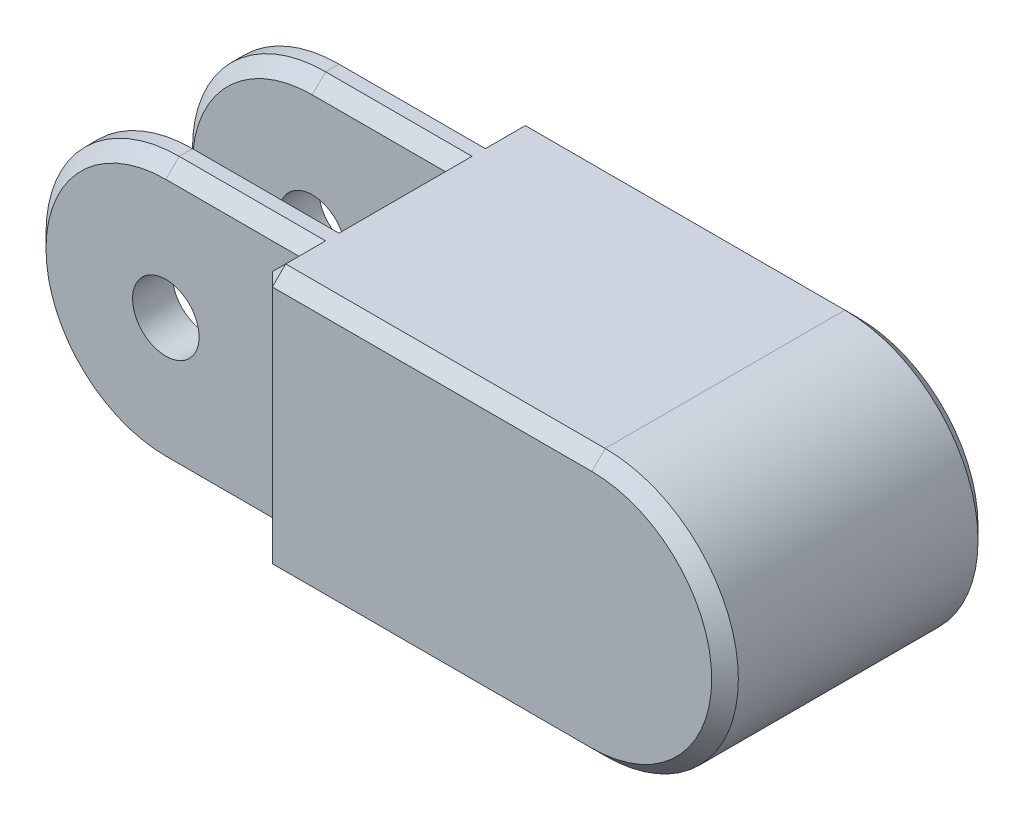
from build123d import *

# Parameters (mm, degrees)
BOSS_EXTRUDE1_DEPTH = 10
CUT_EXTRUDE1_DEPTH  = 4
CUT_EXTRUDE2_START  = -7
CUT_EXTRUDE2_DEPTH  = 7
CUT_EXTRUDE3_START  = 14
CUT_EXTRUDE3_DEPTH  = 7
SKETCH3_R           = 2.5
CUT_EXTRUDE4_DEPTH  = 10
SHELL1_START        = -7
SHELL1_DEPTH        = 14
SHELL1_START_2      = -4
SHELL1_2_OUTLINE_W  = 3
SHELL1_2_OUTLINE_H  = 14
SHELL1_2_DEPTH      = 8
CHAMFER1_SIZE       = 1


# Read off the part's stored shape, not the designer's step: Shell1
with BuildPart() as part:
    # Sketch1 → Boss-Extrude1 (new, symmetric)
    with BuildSketch(Plane.XY):
        with BuildLine():
            Line((-17.5, 10), (17.5, 10))
            ThreePointArc((17.5, 10), (27.5, 0), (17.5, -10))
            Line((17.5, -10), (-17.5, -10))
            ThreePointArc((-17.5, -10), (-27.5, 0), (-17.5, 10))
        make_face()
    extrude(amount=BOSS_EXTRUDE1_DEPTH, both=True)

    # Sketch2 → Cut-Extrude1 (cut, symmetric)
    with BuildSketch(Plane.XY):
        with BuildLine():
            Line((-17.5, 10), (-7.5, 10))
            Line((-7.5, 10), (-7.5, -10))
            Line((-7.5, -10), (-17.5, -10))
            ThreePointArc((-17.5, -10), (-27.5, 0), (-17.5, 10))
        make_face()
    extrude(amount=CUT_EXTRUDE1_DEPTH, both=True, mode=Mode.SUBTRACT)

    # Sketch2<2> → Cut-Extrude2 (cut)
    with BuildSketch(Plane.XY.offset(CUT_EXTRUDE2_START)):
        with BuildLine():
            Line((-17.5, 10), (-7.5, 10))
            Line((-7.5, 10), (-7.5, -10))
            Line((-7.5, -10), (-17.5, -10))
            ThreePointArc((-17.5, -10), (-27.5, 0), (-17.5, 10))
        make_face()
    extrude(amount=-CUT_EXTRUDE2_DEPTH, mode=Mode.SUBTRACT)

    # Sketch2<3> → Cut-Extrude3 (cut)
    with BuildSketch(Plane.XY.offset(CUT_EXTRUDE3_START)):
        with BuildLine():
            Line((-17.5, 10), (-7.5, 10))
            Line((-7.5, 10), (-7.5, -10))
            Line((-7.5, -10), (-17.5, -10))
            ThreePointArc((-17.5, -10), (-27.5, 0), (-17.5, 10))
        make_face()
    extrude(amount=-CUT_EXTRUDE3_DEPTH, mode=Mode.SUBTRACT)

    # Sketch3 → Cut-Extrude4 (cut, symmetric)
    with BuildSketch(Plane.XY):
        with Locations((-17.5, 0)):
            Circle(SKETCH3_R)
    extrude(amount=CUT_EXTRUDE4_DEPTH, both=True, mode=Mode.SUBTRACT)

    # Shell1 outline → Shell1 (cut)
    with BuildSketch(Plane.XY.offset(SHELL1_START)):
        with BuildLine():
            Line((-4.5, -7), (17.5, -7))
            ThreePointArc((17.5, -7), (24.5, 0), (17.5, 7))
            Line((17.5, 7), (-4.5, 7))
            Line((-4.5, 7), (-4.5, -7))
        make_face()
    extrude(amount=SHELL1_DEPTH, mode=Mode.SUBTRACT)

    # Shell1 2 outline → Shell1 2 (cut)
    with BuildSketch(Plane.XY.offset(SHELL1_START_2)):
        with Locations((-6, 0)):
            Rectangle(SHELL1_2_OUTLINE_W, SHELL1_2_OUTLINE_H)
    extrude(amount=SHELL1_2_DEPTH, mode=Mode.SUBTRACT)

    # Chamfer1
    chamfer1_edges = [part.edges().sort_by_distance(p)[0] for p in [
        (27.5, 0, 10),
        (5, 10, 10),
        (-27.5, 0, -4),
        (-12.5, 10, -4),
        (-7.5, 10, 0),
        (-12.5, -10, -4),
        (-7.5, -10, 0),
        (-27.5, 0, 4),
        (-12.5, -10, 4),
        (-12.5, 10, 4),
        (5, -10, -10),
        (-7.5, 0, -10),
        (-7.5, 10, -8.5),
        (-7.5, -10, -8.5),
        (-27.5, 0, -7),
        (-12.5, -10, -7),
        (-12.5, 10, -7),
        (5, 10, -10),
        (5, -10, 10),
        (-7.5, 0, 10),
        (27.5, 0, -10),
        (-27.5, 0, 7),
        (-12.5, -10, 7),
        (-7.5, -10, 8.5),
        (-7.5, 10, 8.5),
        (-12.5, 10, 7),
    ]]
    chamfer(chamfer1_edges, length=CHAMFER1_SIZE)


solid = part.part
